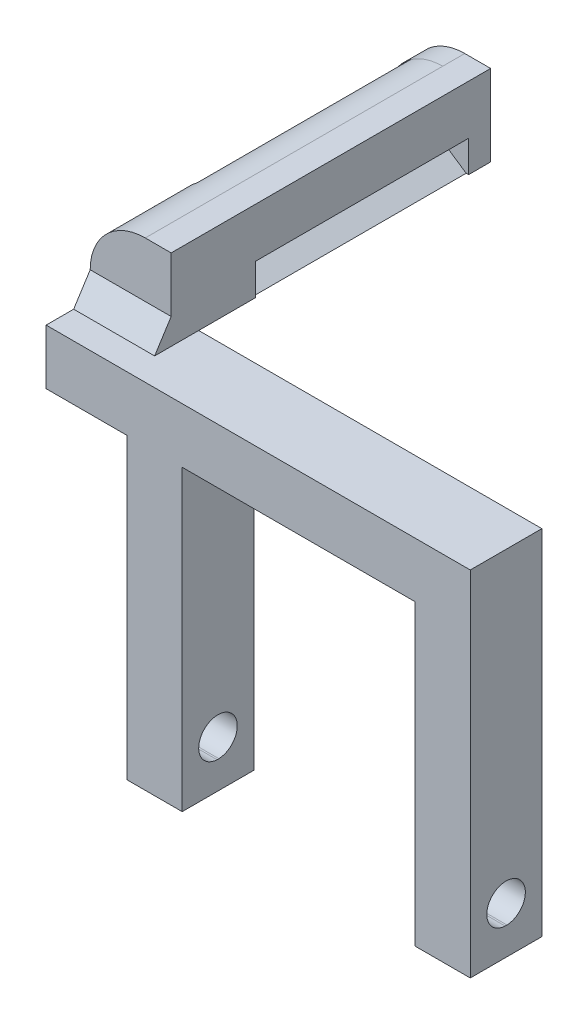
from build123d import *

# Parameters (mm, degrees)
SKETCH_1_W                = 43
SKETCH_1_H                = 10
EXTRUDE_1_DEPTH           = 10
SKETCH_2_W                = 10
SKETCH_2_H                = 10
EXTRUDE_2_DEPTH           = 10
SKETCH_3_W                = 10
SKETCH_3_H                = 10
EXTRUDE_3_DEPTH           = 43.18
SKETCH_4_W                = 10
SKETCH_4_H                = 10
EXTRUDE_4_DEPTH           = 10
SKETCH_5_W                = 10
SKETCH_5_H                = 10
EXTRUDE_5_DEPTH           = 43.18
SKETCH_7_W                = 10
SKETCH_7_H                = 10
EXTRUDE_6_DEPTH           = 14.7
SKETCH_8_W                = 14.7
SKETCH_8_H                = 10
EXTRUDE_7_DEPTH           = 14.7
SKETCH_9_W                = 14.7
SKETCH_9_H                = 14.7
EXTRUDE_8_DEPTH           = 14.7
SKETCH_10_W               = 14.7
SKETCH_10_H               = 14.7
EXTRUDE_10_DEPTH          = 14.82
SKETCH_11_W               = 14.7
SKETCH_11_H               = 14.48
EXTRUDE_11_DEPTH          = 14.82
FILLET_2_R                = 10
CUT_EXTRUDE_1_DEPTH       = 38.7
SKETCH_16_W               = 38.7
SKETCH_16_H               = 0.791061332
CUT_EXTRUDE_2_DEPTH       = 98.525917704
SKETCH_17_W               = 14.259325205
SKETCH_17_H               = 0.12
CUT_EXTRUDE_3_DEPTH       = 38.7
SKETCH_18_W               = 14.7
SKETCH_18_H               = 14.7
EXTRUDE_13_DEPTH          = 4
SKETCH_21_W               = 16.037638094
SKETCH_21_H               = 38.7
CUT_EXTRUDE_4_DEPTH       = 5
FILLET_3_R                = 10
SKETCH_24_W               = 10
SKETCH_24_H               = 53.18
CUT_EXTRUDE_6_DEPTH       = 13
SKETCH_25_W               = 10
SKETCH_25_H               = 1.03
CUT_EXTRUDE_7_DEPTH       = 80.391135525
SKETCH_26_W               = 0.7
SKETCH_26_H               = 10
CUT_EXTRUDE_8_DEPTH       = 79.835667689
SKETCH_27_W               = 10
SKETCH_27_H               = 10
EXTRUDE_15_DEPTH          = 10
SKETCH_28_W               = 10
SKETCH_28_H               = 10
EXTRUDE_16_DEPTH          = 42.15
SKETCH_30_W               = 5
SKETCH_30_H               = 52.15
CUT_EXTRUDE_9_DEPTH       = 89
EXTRUDE_18_DEPTH          = 3
SKETCH_33_W               = 38.7
SKETCH_33_H               = 2.269862795
CUT_EXTRUDE_10_DEPTH      = 3
EXTRUDE_19_DEPTH          = 15
SKETCH_35_W               = 0.3
SKETCH_35_H               = 4.7
CUT_EXTRUDE_11_DEPTH      = 86.293976927
SKETCH_36_W               = 10
SKETCH_36_H               = 8
EXTRUDE_20_DEPTH          = 2
SKETCH_38_W               = 10
SKETCH_38_H               = 8
EXTRUDE_21_DEPTH          = 5
EXTRUDE_22_DEPTH          = 5
CUT_EXTRUDE_13_DEPTH      = 75
CUT_EXTRUDE_13_DEPTH_BACK = 90.218902145
SKETCH_45_R               = 3.5
SKETCH_46_W               = 10
SKETCH_46_H               = 13
EXTRUDE_23_DEPTH          = 5


with BuildPart() as part:
    # 草圖1 → 填料-伸長1 (new body)
    with BuildSketch(Plane(origin=(0, 0, 0), x_dir=(1, 0, 0), z_dir=(0, 1, 0))):
        Rectangle(SKETCH_1_W, SKETCH_1_H)
    extrude(amount=EXTRUDE_1_DEPTH)

    # 草圖2 → 填料-伸長2 (add)
    with BuildSketch(Plane(origin=(21.5, 0, 0), x_dir=(0, 0, -1), z_dir=(1, 0, 0))):
        with Locations((0, 5)):
            Rectangle(SKETCH_2_W, SKETCH_2_H)
    extrude(amount=EXTRUDE_2_DEPTH)

    # 草圖3 → 填料-伸長3 (add)
    with BuildSketch(Plane.XZ):
        with Locations((26.5, 0)):
            Rectangle(SKETCH_3_W, SKETCH_3_H)
    extrude(amount=EXTRUDE_3_DEPTH)

    # 草圖4 → 填料-伸長4 (add)
    with BuildSketch(Plane.ZY.offset(21.5)):
        with Locations((0, 5)):
            Rectangle(SKETCH_4_W, SKETCH_4_H)
    extrude(amount=EXTRUDE_4_DEPTH)

    # 草圖5 → 填料-伸長5 (add)
    with BuildSketch(Plane.XZ):
        with Locations((-26.5, 0)):
            Rectangle(SKETCH_5_W, SKETCH_5_H)
    extrude(amount=EXTRUDE_5_DEPTH)

    # 草圖7 → 填料-伸長6 (add)
    with BuildSketch(Plane.ZY.offset(31.5)):
        with Locations((0, 5)):
            Rectangle(SKETCH_7_W, SKETCH_7_H)
    extrude(amount=EXTRUDE_6_DEPTH)

    # 草圖8 → 填料-伸長7 (add)
    with BuildSketch(Plane(origin=(0, 10, 0), x_dir=(1, 0, 0), z_dir=(0, 1, 0))):
        with Locations((-38.85, 0)):
            Rectangle(SKETCH_8_W, SKETCH_8_H)
    extrude(amount=EXTRUDE_7_DEPTH)

    # 草圖9 → 填料-伸長8 (add)
    with BuildSketch(Plane(origin=(0, 0, -5), x_dir=(-1, 0, 0), z_dir=(0, 0, -1))):
        with Locations((38.85, 17.35)):
            Rectangle(SKETCH_9_W, SKETCH_9_H)
    extrude(amount=EXTRUDE_8_DEPTH)

    # 草圖10 → 填料-伸長10 (add)
    with BuildSketch(Plane(origin=(0, 0, -19.7), x_dir=(-1, 0, 0), z_dir=(0, 0, -1))):
        with Locations((38.85, 17.35)):
            Rectangle(SKETCH_10_W, SKETCH_10_H)
    extrude(amount=EXTRUDE_10_DEPTH)

    # 草圖11 → 填料-伸長11 (add)
    with BuildSketch(Plane(origin=(0, 24.7, 0), x_dir=(1, 0, 0), z_dir=(0, 1, 0))):
        with Locations((-38.85, 41.76)):
            Rectangle(SKETCH_11_W, SKETCH_11_H)
    extrude(amount=-EXTRUDE_11_DEPTH)

    # 圓角2
    fillet_2_edges = [part.edges().sort_by_distance(p)[0] for p in [
        (-46.2, 24.7, -22),
    ]]
    fillet(fillet_2_edges, radius=FILLET_2_R)

    # 草圖15 → 除料-伸長1 (cut)
    with BuildSketch(Plane(origin=(0, 0, -49), x_dir=(-1, 0, 0), z_dir=(0, 0, -1))):
        Polygon((31.5, 10.656950345), (32.021169426, 9.88), (31.5, 9.88), align=None)
    extrude(amount=-CUT_EXTRUDE_1_DEPTH, mode=Mode.SUBTRACT)

    # 草圖16 → 除料-伸長2 (cut, through all)
    with BuildSketch(Plane(origin=(-26.654964144, 17.879845802, 0), x_dir=(0, 0, -1), z_dir=(0.8304670174189052, -0.5570677992662544, 0))):
        with Locations((29.65, -9.092920575)):
            Rectangle(SKETCH_16_W, SKETCH_16_H)
    extrude(amount=-CUT_EXTRUDE_2_DEPTH, mode=Mode.SUBTRACT)

    # 草圖17 → 除料-伸長3 (cut)
    with BuildSketch(Plane(origin=(0, 0, -49), x_dir=(-1, 0, 0), z_dir=(0, 0, -1))):
        with Locations((39.070337398, 9.94)):
            Rectangle(SKETCH_17_W, SKETCH_17_H)
    extrude(amount=-CUT_EXTRUDE_3_DEPTH, mode=Mode.SUBTRACT)

    # 草圖18 → 填料-伸長13 (add)
    with BuildSketch(Plane(origin=(0, 0, -49), x_dir=(-1, 0, 0), z_dir=(0, 0, -1))):
        with Locations((38.85, 17.35)):
            Rectangle(SKETCH_18_W, SKETCH_18_H)
    extrude(amount=EXTRUDE_13_DEPTH)

    # 草圖21 → 除料-伸長4 (cut)
    with BuildSketch(Plane(origin=(-5.285710651, -7.879845802, 0), x_dir=(0.830467017418905, -0.5570677992662544, 0), z_dir=(0.5570677992662545, 0.8304670174189052, 0))):
        with Locations((-40.115173971, 29.65)):
            Rectangle(SKETCH_21_W, SKETCH_21_H)
    extrude(amount=CUT_EXTRUDE_4_DEPTH, mode=Mode.SUBTRACT)

    # 圓角3
    fillet_3_edges = [part.edges().sort_by_distance(p)[0] for p in [
        (-46.2, 24.7, -51),
    ]]
    fillet(fillet_3_edges, radius=FILLET_3_R - 0.0001)  # a hair under: the kernel refuses the full size

    # 草圖24 → 除料-伸長6 (cut)
    with BuildSketch(Plane(origin=(0, 0, -5), x_dir=(-1, 0, 0), z_dir=(0, 0, -1))):
        with Locations((-26.5, -16.59)):
            Rectangle(SKETCH_24_W, SKETCH_24_H)
    extrude(amount=-CUT_EXTRUDE_6_DEPTH, mode=Mode.SUBTRACT)

    # 草圖25 → 除料-伸長7 (cut, through all)
    with BuildSketch(Plane(origin=(0, 0, -5), x_dir=(-1, 0, 0), z_dir=(0, 0, -1))):
        with Locations((26.5, -42.665)):
            Rectangle(SKETCH_25_W, SKETCH_25_H)
    extrude(amount=-CUT_EXTRUDE_7_DEPTH, mode=Mode.SUBTRACT)

    # 草圖26 → 除料-伸長8 (cut, through all)
    with BuildSketch(Plane(origin=(0, 0, -5), x_dir=(-1, 0, 0), z_dir=(0, 0, -1))):
        with Locations((-21.15, 5)):
            Rectangle(SKETCH_26_W, SKETCH_26_H)
    extrude(amount=-CUT_EXTRUDE_8_DEPTH, mode=Mode.SUBTRACT)

    # 草圖27 → 填料-伸長15 (add)
    with BuildSketch(Plane(origin=(20.8, 0, 0), x_dir=(0, 0, -1), z_dir=(1, 0, 0))):
        with Locations((0, 5)):
            Rectangle(SKETCH_27_W, SKETCH_27_H)
    extrude(amount=EXTRUDE_15_DEPTH)

    # 草圖28 → 填料-伸長16 (add)
    with BuildSketch(Plane.XZ):
        with Locations((25.8, 0)):
            Rectangle(SKETCH_28_W, SKETCH_28_H)
    extrude(amount=EXTRUDE_16_DEPTH)

    # 草圖30 → 除料-伸長9 (cut)
    with BuildSketch(Plane(origin=(30.8, 0, 0), x_dir=(0, 0, -1), z_dir=(1, 0, 0))):
        with Locations((2.5, -16.075)):
            Rectangle(SKETCH_30_W, SKETCH_30_H)
    extrude(amount=-CUT_EXTRUDE_9_DEPTH, mode=Mode.SUBTRACT)

    # 草圖32 → 填料-伸長18 (add)
    with BuildSketch(Plane.XY.offset(5)):
        Polygon((20.8, -42.15), (30.8, -42.15), (30.8, 10), (-46.2, 10), (-46.2, 0), (-31.5, 0), (-31.5, -42.15), (-21.5, -42.15), (-21.5, 0), (20.8, 0), align=None)
    extrude(amount=EXTRUDE_18_DEPTH)

    # 草圖33 → 除料-伸長10 (cut)
    with BuildSketch(Plane(origin=(-39.973693618, 26.81389756, 0), x_dir=(0, 0, -1), z_dir=(0.830467017418905, -0.5570677992662545, 0))):
        with Locations((29.65, -7.562458512)):
            Rectangle(SKETCH_33_W, SKETCH_33_H)
    extrude(amount=-CUT_EXTRUDE_10_DEPTH, mode=Mode.SUBTRACT)

    # 草圖34 → 填料-伸長19 (add)
    with BuildSketch(Plane.ZY.offset(46.2)):
        Polygon((5, 14.7), (8, 10), (5, 10), align=None)
    extrude(amount=-EXTRUDE_19_DEPTH)

    # 草圖35 → 除料-伸長11 (cut, through all)
    with BuildSketch(Plane(origin=(0, 0, 5), x_dir=(-1, 0, 0), z_dir=(0, 0, -1))):
        with Locations((31.35, 12.35)):
            Rectangle(SKETCH_35_W, SKETCH_35_H)
    extrude(amount=-CUT_EXTRUDE_11_DEPTH, mode=Mode.SUBTRACT)

    # 草圖36 → 填料-伸長20 (add)
    with BuildSketch(Plane.XZ.offset(42.15)):
        with Locations((25.8, 4)):
            Rectangle(SKETCH_36_W, SKETCH_36_H)
        with Locations((-26.5, 4)):
            Rectangle(SKETCH_36_W, SKETCH_36_H)
    extrude(amount=EXTRUDE_20_DEPTH)

    # 草圖38 → 填料-伸長21 (add)
    with BuildSketch(Plane.XZ.offset(44.15)):
        with Locations((25.8, 4)):
            Rectangle(SKETCH_38_W, SKETCH_38_H)
        with Locations((-26.5, 4)):
            Rectangle(SKETCH_38_W, SKETCH_38_H)
    extrude(amount=EXTRUDE_21_DEPTH)

    # 草圖41 → 填料-伸長22 (add)
    with BuildSketch(Plane.XY.offset(8)):
        Polygon((-46.2, 10), (-46.2, 0), (-31.5, 0), (-31.5, -49.15), (-21.5, -49.15), (-21.5, 0), (20.8, 0), (20.8, -49.15), (30.8, -49.15), (30.8, 10), align=None)
    extrude(amount=EXTRUDE_22_DEPTH)

    # 草圖45 → 除料-伸長13 (cut, two sides: drawn at the far end of the back side and taken through both)
    with BuildSketch(Plane(origin=(-21.5, 0, 0), x_dir=(0, 0, -1), z_dir=(1, 0, 0)).offset(-CUT_EXTRUDE_13_DEPTH_BACK)):
        with Locations((-6.5, -45.653779556)):
            Circle(SKETCH_45_R)
    extrude(amount=CUT_EXTRUDE_13_DEPTH + CUT_EXTRUDE_13_DEPTH_BACK, mode=Mode.SUBTRACT)

    # 草圖46 → 填料-伸長23 (add)
    with BuildSketch(Plane.XZ.offset(49.15)):
        with Locations((25.8, 6.5)):
            Rectangle(SKETCH_46_W, SKETCH_46_H)
        with Locations((-26.5, 6.5)):
            Rectangle(SKETCH_46_W, SKETCH_46_H)
    extrude(amount=EXTRUDE_23_DEPTH)


solid = part.part
